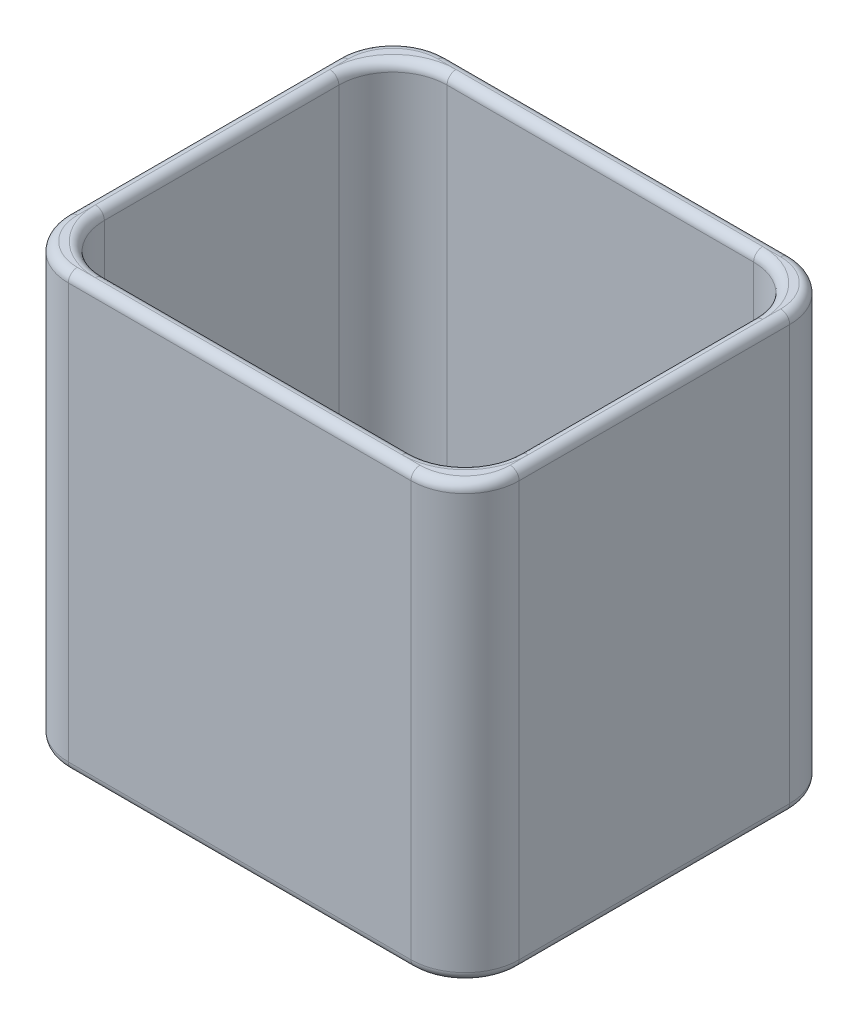
from build123d import *

# Parameters (mm, degrees)
SKETCH1_W           = 79.375
SKETCH1_H           = 66.675
SKETCH1_W_2         = 73.025
SKETCH1_H_2         = 60.325
EXTRUDE_THIN1_DEPTH = 73.025
FILLET1_R           = 9.525
BOSS_EXTRUDE1_DEPTH = 3.175
FILLET2_R           = 6.35
FILLET3_R           = 1.5875


with BuildPart() as part:
    # Sketch1 → Extrude-Thin1 (new body)
    with BuildSketch(Plane(origin=(0, 0, 0), x_dir=(1, 0, 0), z_dir=(0, 1, 0))):
        Rectangle(SKETCH1_W, SKETCH1_H)
        Rectangle(SKETCH1_W_2, SKETCH1_H_2, mode=Mode.SUBTRACT)
    extrude(amount=EXTRUDE_THIN1_DEPTH)

    # Fillet1
    fillet1_edges = [part.edges().sort_by_distance(p)[0] for p in [
        (36.5125, 36.5125, 30.1625),
        (36.5125, 36.5125, -30.1625),
        (-36.5125, 36.5125, -30.1625),
        (-36.5125, 36.5125, 30.1625),
        (39.6875, 36.5125, 33.3375),
        (-39.6875, 36.5125, 33.3375),
        (-39.6875, 36.5125, -33.3375),
        (39.6875, 36.5125, -33.3375),
    ]]
    fillet(fillet1_edges, radius=FILLET1_R)

    # Sketch2 → Boss-Extrude1 (add)
    with BuildSketch(Plane.XZ):
        with BuildLine():
            Line((39.6875, -23.8125), (39.6875, 23.8125))
            ThreePointArc((39.6875, 23.8125), (36.897692091, 30.547692091), (30.1625, 33.3375))
            Line((30.1625, 33.3375), (-30.1625, 33.3375))
            ThreePointArc((-30.1625, 33.3375), (-36.897692091, 30.547692091), (-39.6875, 23.8125))
            Line((-39.6875, 23.8125), (-39.6875, -23.8125))
            ThreePointArc((-39.6875, -23.8125), (-36.897692091, -30.547692091), (-30.1625, -33.3375))
            Line((-30.1625, -33.3375), (30.1625, -33.3375))
            ThreePointArc((30.1625, -33.3375), (36.897692091, -30.547692091), (39.6875, -23.8125))
        make_face()
    extrude(amount=BOSS_EXTRUDE1_DEPTH)

    # Fillet2
    fillet2_edges = [part.edges().sort_by_distance(p)[0] for p in [
        (-36.5125, 0, 0),
        (0, 0, 30.1625),
        (36.5125, 0, 0),
        (0, 0, -30.1625),
        (-33.722692091, 0, 27.372692091),
        (33.722692091, 0, 27.372692091),
        (33.722692091, 0, -27.372692091),
        (-33.722692091, 0, -27.372692091),
    ]]
    fillet(fillet2_edges, radius=FILLET2_R)

    # Fillet3
    fillet3_edges = [part.edges().sort_by_distance(p)[0] for p in [
        (-36.5125, 73.025, 0),
        (0, 73.025, 30.1625),
        (36.5125, 73.025, 0),
        (0, 73.025, -30.1625),
        (39.6875, 73.025, 0),
        (0, 73.025, 33.3375),
        (0, 73.025, -33.3375),
        (-39.6875, 73.025, 0),
        (36.897692091, 73.025, -30.547692091),
        (-36.897692091, 73.025, -30.547692091),
        (-36.897692091, 73.025, 30.547692091),
        (36.897692091, 73.025, 30.547692091),
        (-33.722692091, 73.025, 27.372692091),
        (33.722692091, 73.025, 27.372692091),
        (33.722692091, 73.025, -27.372692091),
        (-33.722692091, 73.025, -27.372692091),
        (36.897692091, -3.175, -30.547692091),
        (39.6875, -3.175, 0),
        (36.897692091, -3.175, 30.547692091),
        (0, -3.175, 33.3375),
        (-36.897692091, -3.175, 30.547692091),
        (-39.6875, -3.175, 0),
        (-36.897692091, -3.175, -30.547692091),
        (0, -3.175, -33.3375),
    ]]
    fillet(fillet3_edges, radius=FILLET3_R - 0.0001)  # a hair under: the kernel refuses the full size

    # Sketch4 → Cut-Revolve1 (revolve, cut)
    with BuildSketch(Plane.YX.offset(19.05), mode=Mode.PRIVATE) as cut_revolve1_sk:
        Polygon((-3.175, -23.33625), (-1.240026103, -23.33625), (0, -21.2725), (0, -25.4), (-3.175, -25.4), align=None)
    cut_revolve1 = revolve(cut_revolve1_sk.sketch.rotate(Axis((-25.4, 0, -19.05), (0, -1, 0)), 90), axis=Axis((-25.4, 0, -19.05), (0, -1, 0)), mode=Mode.SUBTRACT)

    # Mirror1: Cut-Revolve1 across plane
    add(cut_revolve1.mirror(Plane(origin=(0, 0, 0), x_dir=(0, 0, 1), z_dir=(1, 0, 0))), mode=Mode.SUBTRACT)

    # Mirror2: Cut-Revolve1 across plane
    add(cut_revolve1.mirror(Plane.XY), mode=Mode.SUBTRACT)

    # Mirror2 copy 1 sketch → Mirror2 copy 1 (revolve, cut)
    with BuildSketch(Plane(origin=(0, 0, 19.05), x_dir=(0, 1, 0), z_dir=(0, 0, 1))):
        Polygon((-3.175, -23.33625), (-1.240026103, -23.33625), (0, -21.2725), (0, -25.4), (-3.175, -25.4), align=None)
    revolve(axis=Axis((25.4, 0, 19.05), (0, -1, 0)), mode=Mode.SUBTRACT)


solid = part.part
